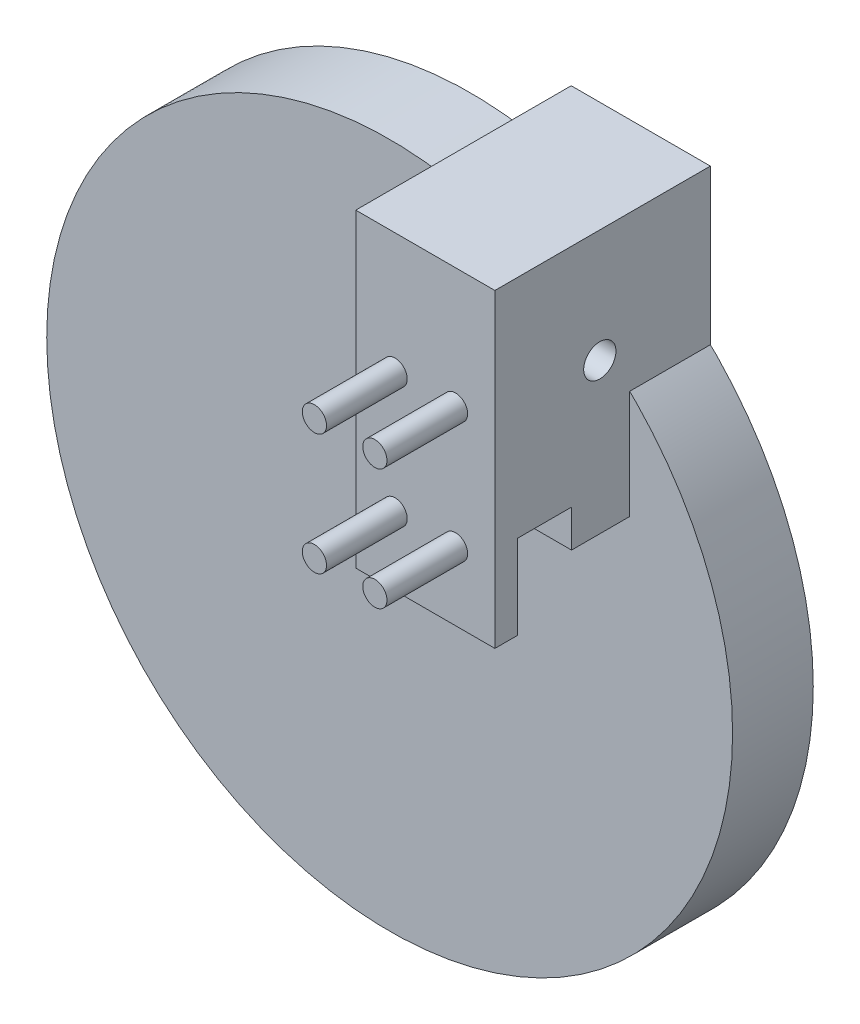
from build123d import *

# Parameters (mm, degrees)
SKETCH4_R               = 42.5
BASE_DEPTH              = 10
SKETCH5_W               = 17.242861366
SKETCH5_H               = 43.5
BOSS_EXTRUDE1_DEPTH     = 17.2
SKETCH6_W               = 13.242861366
SKETCH6_H               = 13.2
CUT_EXTRUDE1_DEPTH      = 24
SKETCH9_R               = 1.5
BOSS_EXTRUDE2_DEPTH     = 5
WRAP1_START             = -22.242861366
WRAP1_OUTLINE_R         = 1.5
WRAP1_DEPTH             = 5
SKETCH14_W              = 14
SKETCH14_H              = 28
BOSS_EXTRUDE4_DEPTH     = 17.242861366
SKETCH16_R              = 14
CUT_EXTRUDE2_DEPTH      = 17.242861366
CUT_EXTRUDE4_REACH      = 108.036
SKETCH19_W              = 17.242861366
SKETCH19_H              = 4.5
CUT_EXTRUDE6_REACH      = 71.795
CUT_EXTRUDE6_END_RADIUS = 14
SKETCH22_W              = 17.242861366
SKETCH22_H              = 2.8
SKETCH23_R              = 2
CUT_EXTRUDE7_DEPTH      = 17.242861366
CUT_EXTRUDE8_REACH      = 80.665
SKETCH24_W              = 17.2
SKETCH24_H              = 5.3
CUT_EXTRUDE9_REACH      = 80.665
SKETCH25_W              = 27.034559723
SKETCH25_H              = 9.24407526
SKETCH26_W              = 2.8
SKETCH26_H              = 10.42050917
BOSS_EXTRUDE5_DEPTH     = 17.242861366
SKETCH27_R              = 1.5
BOSS_EXTRUDE6_DEPTH     = 10


# Read off the part's stored shape, not the designer's step: Wrap1
with BuildPart() as part:
    # Sketch4 → base (new body)
    with BuildSketch(Plane.XY):
        Circle(SKETCH4_R)
    extrude(amount=BASE_DEPTH)


with BuildPart() as body_2:
    # Sketch5 → Boss-Extrude1 (new body)
    with BuildSketch(Plane.XY):
        with Locations((21.121430683, 27.75)):
            Rectangle(SKETCH5_W, SKETCH5_H)
    extrude(amount=BOSS_EXTRUDE1_DEPTH)

    # Sketch6 → Cut-Extrude1 (cut)
    with BuildSketch(Plane(origin=(0, 6, 0), x_dir=(-1, 0, 0), z_dir=(0, -1, 0))):
        with Locations((-21.121430683, -8.6)):
            Rectangle(SKETCH6_W, SKETCH6_H)
    extrude(amount=-CUT_EXTRUDE1_DEPTH, mode=Mode.SUBTRACT)

    # Sketch9 → Boss-Extrude2 (add)
    with BuildSketch(Plane(origin=(29.742861366, 0, 0), x_dir=(0, 0, -1), z_dir=(1, 0, 0))):
        with Locations(Location((-7.5, 18.722537456, 0), (0, 0, 180))):
            Circle(SKETCH9_R)
    extrude(amount=BOSS_EXTRUDE2_DEPTH)

    # Wrap1 outline → Wrap1 (add)
    with BuildSketch(Plane(origin=(29.742861366, 0, 0), x_dir=(0, 0, -1), z_dir=(1, 0, 0)).offset(WRAP1_START)):
        with Locations((-7.5, 18.722537456)):
            Circle(WRAP1_OUTLINE_R)
    extrude(amount=WRAP1_DEPTH)

    # Sketch14 → Boss-Extrude4 (add)
    with BuildSketch(Plane(origin=(29.742861366, 0, 0), x_dir=(0, 0, -1), z_dir=(1, 0, 0))):
        with Locations((-24.2, 35.5)):
            Rectangle(SKETCH14_W, SKETCH14_H)
    extrude(amount=-BOSS_EXTRUDE4_DEPTH)

    # Sketch16 → Cut-Extrude2 (cut)
    with BuildSketch(Plane(origin=(29.742861366, 0, 0), x_dir=(0, 0, -1), z_dir=(1, 0, 0))):
        with Locations((-31.2, 35.5)):
            Circle(SKETCH16_R)
    extrude(amount=-CUT_EXTRUDE2_DEPTH, mode=Mode.SUBTRACT)

    # Cut-Extrude4: up to this face of the body (flat: up to its plane)
    cut_extrude4_end = Plane(body_2.part.faces().sort_by_distance((21.121430683, 21.5, 24.2))[0])
    # Sketch19 → Cut-Extrude4 (cut, up to the picked face)
    with BuildSketch(Plane(origin=(0, 49.5, 0), x_dir=(1, 0, 0), z_dir=(0, 1, 0)), mode=Mode.PRIVATE) as cut_extrude4_sk1:
        with Locations((21.121430683, -28.95)):
            Rectangle(SKETCH19_W, SKETCH19_H)
    cut_extrude4_tool1 = split(extrude(cut_extrude4_sk1.sketch, amount=-CUT_EXTRUDE4_REACH, mode=Mode.PRIVATE), bisect_by=cut_extrude4_end, keep=Keep.BOTH, mode=Mode.PRIVATE)
    add(cut_extrude4_tool1.solids().sort_by(Axis((21.121431, 49.5, 28.95), (0, -1, 0)))[0], mode=Mode.SUBTRACT)

    # Cut-Extrude6: up to this cylinder (the profile starts outside it)
    cut_extrude6_end = Plane(origin=(21.121431, 35.5, 31.2), z_dir=(1, 0, 0)) * Cylinder(CUT_EXTRUDE6_END_RADIUS, 172.59, mode=Mode.PRIVATE)
    # Sketch22 → Cut-Extrude6 (cut, up to the surface)
    with BuildSketch(Plane(origin=(0, 6, 0), x_dir=(-1, 0, 0), z_dir=(0, -1, 0)), mode=Mode.PRIVATE) as cut_extrude6_sk1:
        with Locations((-21.121430683, -25.3)):
            Rectangle(SKETCH22_W, SKETCH22_H)
    cut_extrude6_tool1 = extrude(cut_extrude6_sk1.sketch, amount=-CUT_EXTRUDE6_REACH, mode=Mode.PRIVATE) - cut_extrude6_end
    add(cut_extrude6_tool1.solids().sort_by_distance((21.121431, 6, 25.3))[0], mode=Mode.SUBTRACT)

    # Sketch23 → Cut-Extrude7 (cut)
    with BuildSketch(Plane(origin=(29.742861366, 0, 0), x_dir=(0, 0, -1), z_dir=(1, 0, 0))):
        with Locations(Location((-13.7, 35.5, 0), (0, 0, 90))):
            Circle(SKETCH23_R)
    extrude(amount=-CUT_EXTRUDE7_DEPTH, mode=Mode.SUBTRACT)

    # Cut-Extrude8: up to this face of the body (flat: up to its plane)
    cut_extrude8_end = Plane(body_2.part.faces().sort_by_distance((29.742861366, 28.520960227, 9.624194882))[0])
    # Sketch24 → Cut-Extrude8 (cut, up to the picked face)
    with BuildSketch(Plane.ZY.offset(-12.5), mode=Mode.PRIVATE) as cut_extrude8_sk1:
        with Locations((8.6, 8.65)):
            Rectangle(SKETCH24_W, SKETCH24_H)
    cut_extrude8_tool1 = split(extrude(cut_extrude8_sk1.sketch, amount=-CUT_EXTRUDE8_REACH, mode=Mode.PRIVATE), bisect_by=cut_extrude8_end, keep=Keep.BOTH, mode=Mode.PRIVATE)
    add(cut_extrude8_tool1.solids().sort_by(Axis((12.5, 8.65, 8.6), (1, 0, 0)))[0], mode=Mode.SUBTRACT)

    # Cut-Extrude9: up to this face of the body (flat: up to its plane)
    cut_extrude9_end = Plane(body_2.part.faces().sort_by_distance((29.742861366, 31.052365507, 9.754669319))[0])
    # Sketch25 → Cut-Extrude9 (cut, up to the picked face)
    with BuildSketch(Plane.ZY.offset(-12.5), mode=Mode.PRIVATE) as cut_extrude9_sk1:
        with Locations((8.495407017, 12.260670009)):
            Rectangle(SKETCH25_W, SKETCH25_H)
    cut_extrude9_tool1 = split(extrude(cut_extrude9_sk1.sketch, amount=-CUT_EXTRUDE9_REACH, mode=Mode.PRIVATE), bisect_by=cut_extrude9_end, keep=Keep.BOTH, mode=Mode.PRIVATE)
    add(cut_extrude9_tool1.solids().sort_by(Axis((12.5, 12.26067, 8.495407), (1, 0, 0)))[0], mode=Mode.SUBTRACT)

    # Sketch26 → Boss-Extrude5 (add)
    with BuildSketch(Plane.ZY.offset(-12.5)):
        Polygon((16.229247073, 48.406672833), (17.2, 21.5), (23.9, 21.5), (26.7, 21.5), (26.7, 48.757073584), align=None)
        with Locations((25.3, 16.289745415)):
            Rectangle(SKETCH26_W, SKETCH26_H)
    extrude(amount=-BOSS_EXTRUDE5_DEPTH)

    # Sketch27 → Boss-Extrude6 (add)
    with BuildSketch(Plane.XY.offset(26.7)):
        with Locations(Location((24.866448866, 19.560624718, 0), (0, 0, 180))):
            Circle(SKETCH27_R)
        with Locations(Location((17.3764125, 19.560624718, 0), (0, 0, 180))):
            Circle(SKETCH27_R)
        with Locations(Location((24.866448866, 34.560624718, 0), (0, 0, 180))):
            Circle(SKETCH27_R)
        with Locations(Location((17.3764125, 34.560624718, 0), (0, 0, 180))):
            Circle(SKETCH27_R)
    extrude(amount=BOSS_EXTRUDE6_DEPTH)


solid = Compound([part.part, body_2.part])
